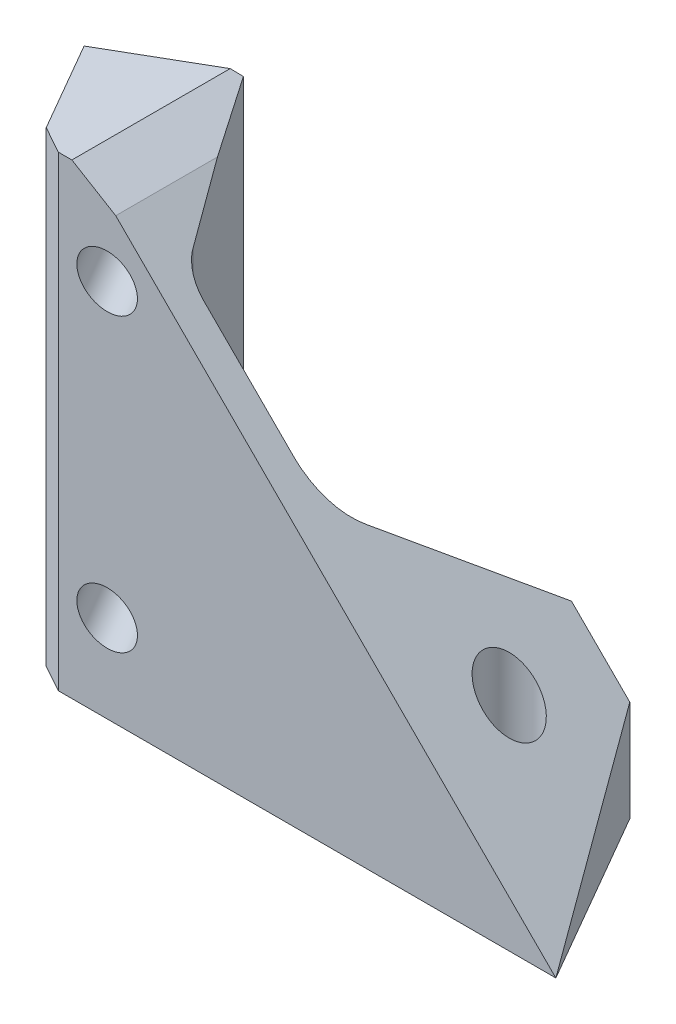
from build123d import *

# Parameters (mm, degrees)
BOSS_EXTRUDE1_DEPTH     = 80
CUT_EXTRUDE1_DEPTH      = 60
FILLET3_R               = 10
CUT_EXTRUDE3_DEPTH      = 171.057006102
CUT_EXTRUDE3_DEPTH_BACK = 171.057006102
SKETCH34_R              = 2.3
SKETCH35_R              = 4.5
CUT_EXTRUDE4_DEPTH      = 170.183744927
SKETCH36_R              = 2.3
CUT_EXTRUDE5_DEPTH      = 173.626765016
SKETCH37_R              = 4.5
CUT_EXTRUDE6_DEPTH      = 171.809835782
CHAMFER1_SIZE           = 3
CHAMFER1_SIZE2          = 3.187509412
CHAMFER3_SIZE           = 3
CHAMFER3_SIZE2          = 6.386830844


with BuildPart() as part:
    # Sketch31 → Boss-Extrude1 (new body)
    with BuildSketch(Plane(origin=(0, 0, 0), x_dir=(1, 0, 0), z_dir=(0, 1, 0))):
        with BuildLine():
            Line((51.120447452, 17.972270867), (61.498642548, 0))
            Line((61.498642548, 0), (78, 0))
            Line((78, 0), (150, 0))
            Line((150, 0), (132.679491924, 30))
            Line((132.679491924, 30), (122.679491924, 30))
            Line((122.679491924, 30), (105.174303469, 5))
            Line((105.174303469, 5), (84.592917657, 5))
            ThreePointArc((84.592917657, 5), (82.093089287, 5.669773895), (80.26298883, 7.499656752))
            Line((80.26298883, 7.499656752), (68.440162758, 27.973643859))
            Line((68.440162758, 27.973643859), (51.120447452, 17.972270867))
        make_face()
    extrude(amount=BOSS_EXTRUDE1_DEPTH)

    # Sketch32 → Cut-Extrude1 (cut)
    with BuildSketch(Plane.XY):
        Polygon((70, 80), (150, 0), (150, 80), align=None)
    extrude(amount=-CUT_EXTRUDE1_DEPTH, mode=Mode.SUBTRACT)

    # Fillet3
    fillet3_edges = [part.edges().sort_by_distance(p)[0] for p in [
        (105.174303469, 22.412848265, -5),
    ]]
    fillet(fillet3_edges, radius=FILLET3_R)

    # Sketch34 → Cut-Extrude3 (cut, two sides: drawn at the far end of the back side and taken through both)
    with BuildSketch(Plane(origin=(5.000687688, 0, 8.659859718), x_dir=(-0.8659857652883414, 0, 0.5000686496051975), z_dir=(-0.5000686496051975, 0, -0.8659857652883415)).offset(-CUT_EXTRUDE3_DEPTH_BACK)):
        with Locations((-63.256949031, 15)):
            Circle(SKETCH34_R)
        with Locations((-63.256949031, 65)):
            Circle(SKETCH34_R)
    extrude(amount=CUT_EXTRUDE3_DEPTH + CUT_EXTRUDE3_DEPTH_BACK, mode=Mode.SUBTRACT)

    # Sketch35 → Cut-Extrude4 (cut, through all)
    with BuildSketch(Plane(origin=(7.000962287, 0, 12.123802779), x_dir=(-0.8659857652883414, 0, 0.5000686496051975), z_dir=(-0.5000686496051975, 0, -0.8659857652883415))):
        with Locations((-63.256949031, 65)):
            Circle(SKETCH35_R)
        with Locations((-63.256949031, 15)):
            Circle(SKETCH35_R)
    extrude(amount=-CUT_EXTRUDE4_DEPTH, mode=Mode.SUBTRACT)

    # Sketch36 → Cut-Extrude5 (cut, through all)
    with BuildSketch(Plane.XZ):
        with Locations((127, -15)):
            Circle(SKETCH36_R)
    extrude(amount=-CUT_EXTRUDE5_DEPTH, mode=Mode.SUBTRACT)

    # Sketch37 → Cut-Extrude6 (cut, through all)
    with BuildSketch(Plane(origin=(0, 4, 0), x_dir=(-1, 0, 0), z_dir=(0, -1, 0))):
        with Locations((-127, 15)):
            Circle(SKETCH37_R)
    extrude(amount=-CUT_EXTRUDE6_DEPTH, mode=Mode.SUBTRACT)

    # Chamfer1
    chamfer1_edges = [part.edges().sort_by_distance(p)[0] for p in [
        (61.498642548, 40, 0),
    ]]
    chamfer1_side = [part.faces().sort_by_distance(p)[0] for p in [
        (56.309545, 40, -8.986135433),
    ]]
    chamfer(chamfer1_edges, length=CHAMFER1_SIZE, length2=CHAMFER1_SIZE2, reference=chamfer1_side[0])

    # Chamfer3
    chamfer3_edges = [part.edges().sort_by_distance(p)[0] for p in [
        (70, 80, -12.636210519),
    ]]
    chamfer3_side = [part.faces().sort_by_distance(p)[0] for p in [
        (63.046344203, 80, -13.547671915),
    ]]
    chamfer(chamfer3_edges, length=CHAMFER3_SIZE, length2=CHAMFER3_SIZE2, reference=chamfer3_side[0])


solid = part.part
